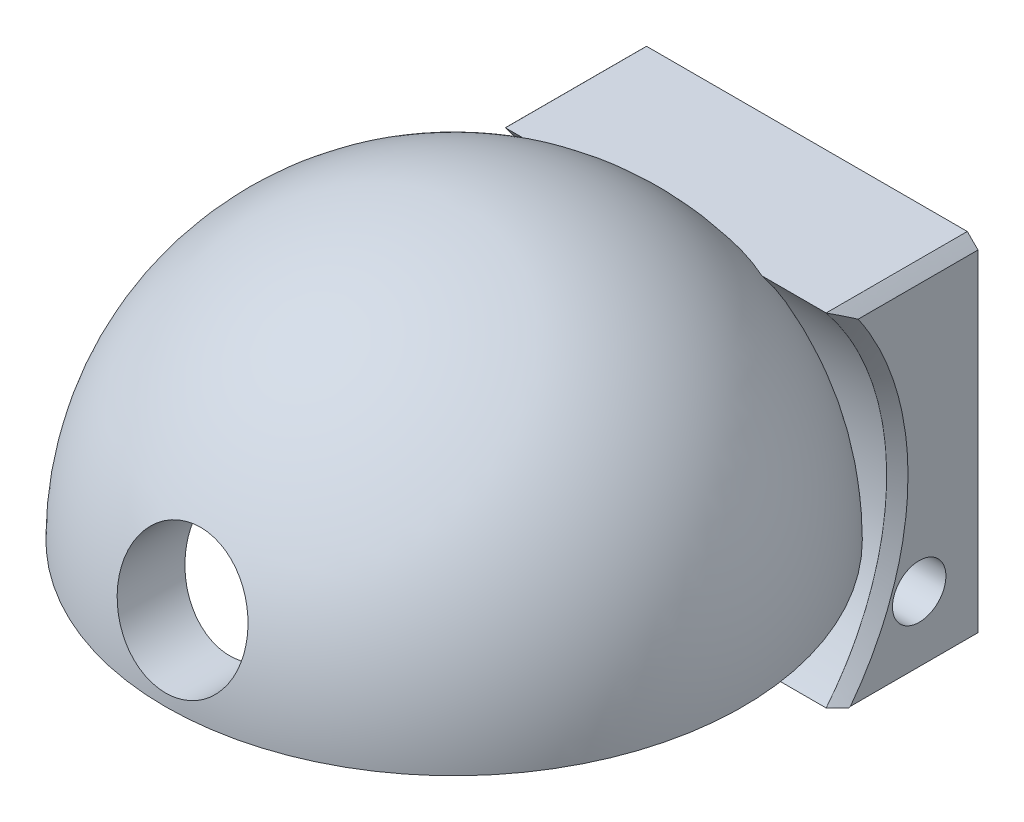
from build123d import *

# Parameters (mm, degrees)
BOSS_EXTRUDE1_REACH      = 42.773
BOSS_EXTRUDE1_END_RADIUS = 13.5
SKETCH3_W                = 9
SKETCH3_H                = 8
SKETCH3_R                = 1.25
SKETCH4_R                = 2.95
CUT_EXTRUDE1_DEPTH       = 39.618907907
BOSS_EXTRUDE2_DEPTH      = 3.5
FILLET1_SIZE             = 0.5
FILLET1_OF_MIRROR1_SIZE  = 0.5
SKETCH6_R                = 1.25
CUT_EXTRUDE2_DEPTH       = 40.847777024


with BuildPart() as part:
    # Sketch2 → Revolve1 (revolve)
    with BuildSketch(Plane.ZY.offset(3.25)):
        with BuildLine():
            Line((11.871988211, 18.951253904), (11.871988211, 21.951253904))
            ThreePointArc((11.871988211, 21.951253904), (2.326046665, 17.99719545), (-1.628011789, 8.451253904))
            Line((-1.628011789, 8.451253904), (1.371988211, 8.451253904))
            ThreePointArc((1.371988211, 8.451253904), (4.447367009, 15.875875106), (11.871988211, 18.951253904))
        make_face()
    revolve(axis=Axis((-3.25, 21.951253904, 11.871988211), (0, -1, 0)))

    # Boss-Extrude1: up to this sphere (the profile starts outside it)
    boss_extrude1_end = Location((-3.25, 8.451253904, 11.871988211)) * Sphere(BOSS_EXTRUDE1_END_RADIUS, mode=Mode.PRIVATE)
    # Sketch3 → Boss-Extrude1 (add, up to the surface)
    with BuildSketch(Plane.XY.offset(-4.628011789), mode=Mode.PRIVATE) as boss_extrude1_sk1:
        with Locations((-3.25, 12.451253904)):
            Rectangle(SKETCH3_W, SKETCH3_H)
        with Locations(Location((-3.25, 11.951253904, 0), (0, 0, 234.39930335))):
            Circle(SKETCH3_R, mode=Mode.SUBTRACT)
    boss_extrude1_tool1 = extrude(boss_extrude1_sk1.sketch, amount=BOSS_EXTRUDE1_REACH, mode=Mode.PRIVATE) - boss_extrude1_end
    add(boss_extrude1_tool1.solids().sort_by_distance((-3.25, 8.57167, -4.628012))[0])

    # Sketch4 → Cut-Extrude1 (cut, through all)
    with BuildSketch(Plane.XY.offset(-1.628011789)):
        with Locations(Location((-3.25, 11.951253904, 0), (0, 0, 220.0479249))):
            Circle(SKETCH4_R)
    extrude(amount=CUT_EXTRUDE1_DEPTH, mode=Mode.SUBTRACT)

    # Sketch5 → Boss-Extrude2 (add)
    with BuildSketch(Plane(origin=(1.25, 0, 0), x_dir=(0, 0, -1), z_dir=(1, 0, 0))):
        with BuildLine():
            Line((4.628011789, 16.451253904), (-1.972493274, 16.451253904))
            ThreePointArc((-1.972493274, 16.451253904), (0.128011789, 12.693894591), (0.85593385, 8.451253904))
            ThreePointArc((0.85593385, 8.451253904), (0.128011789, 4.208613217), (-1.972493274, 0.451253904))
            Line((-1.972493274, 0.451253904), (4.628011789, 0.451253904))
            Line((4.628011789, 0.451253904), (4.628011789, 16.451253904))
        make_face()
    boss_extrude2 = extrude(amount=BOSS_EXTRUDE2_DEPTH)

    # Fillet1
    # a fillet whose section is not a circle: 0.5 mm, written as the material it takes off along each edge
    with BuildSketch(Plane(origin=(4.75, 16.451253904, -5.878011789), x_dir=(0, -1, 0), z_dir=(0, 0, 1))) as fillet1_piece_1:
        with BuildLine():
            Bezier((FILLET1_SIZE, 0), (0, 0), (0, -FILLET1_SIZE), weights=[1, 0.007071068, 1])
            Line((0, -FILLET1_SIZE), (0, 0))
            Line((0, 0), (FILLET1_SIZE, 0))
        make_face()
    extrude(amount=9.100505063, mode=Mode.SUBTRACT)
    with BuildSketch(Plane(origin=(4.75, 8.451253904, 11.871988211), x_dir=(0, -0.701793953553333, -0.7123799876161475), z_dir=(0, -0.7123799876161475, 0.701793953553333))) as fillet1_piece_2:
        with BuildLine():
            Bezier((12.727922061 + FILLET1_SIZE, 0), (12.727922061, 0), (12.727922061, -FILLET1_SIZE), weights=[1, 0.007071068, 1])
            Line((12.727922061, -FILLET1_SIZE), (12.727922061, 0))
            Line((12.727922061, 0), (12.727922061 + FILLET1_SIZE, 0))
        make_face()
    revolve(axis=Axis((4.75, 8.451253904, 11.871988211), (1, 0, 0)), revolution_arc=89.142221862, mode=Mode.SUBTRACT)

    # Mirror1: Boss-Extrude2 across plane
    add(boss_extrude2.mirror(Plane.ZY.offset(3.25)))

    # Fillet1 of Mirror1
    # a fillet whose section is not a circle: 0.5 mm, written as the material it takes off along each edge
    with BuildSketch(Plane(origin=(-11.25, 16.451253904, -5.878011789), x_dir=(1, 0, 0), z_dir=(0, 0, 1))) as fillet1_of_mirror1_piece_1:
        with BuildLine():
            Bezier((FILLET1_OF_MIRROR1_SIZE, 0), (0, 0), (0, -FILLET1_OF_MIRROR1_SIZE), weights=[1, 0.007071068, 1])
            Line((0, -FILLET1_OF_MIRROR1_SIZE), (0, 0))
            Line((0, 0), (FILLET1_OF_MIRROR1_SIZE, 0))
        make_face()
    extrude(amount=9.100505063, mode=Mode.SUBTRACT)
    with BuildSketch(Plane(origin=(-11.25, 8.451253904, 11.871988211), x_dir=(9.769464187365758e-15, -0.701793953553333, -0.7123799876161475), z_dir=(9.869955665254962e-15, -0.7123799876161475, 0.701793953553333))) as fillet1_of_mirror1_piece_2:
        with BuildLine():
            Bezier((12.727922061 + FILLET1_OF_MIRROR1_SIZE, 0), (12.727922061, 0), (12.727922061, FILLET1_OF_MIRROR1_SIZE), weights=[1, 0.007071068, 1])
            Line((12.727922061, FILLET1_OF_MIRROR1_SIZE), (12.727922061, 0))
            Line((12.727922061, 0), (12.727922061 + FILLET1_OF_MIRROR1_SIZE, 0))
        make_face()
    revolve(axis=Axis((-11.25, 8.451253904, 11.871988211), (1, 0, 0)), revolution_arc=89.142221862, mode=Mode.SUBTRACT)

    # Sketch6 → Cut-Extrude2 (cut, through all)
    with BuildSketch(Plane(origin=(4.75, 0, 0), x_dir=(0, 0, -1), z_dir=(1, 0, 0))):
        with Locations(Location((1.878011789, 3.496708449, 0), (0, 0, 270))):
            Circle(SKETCH6_R)
    extrude(amount=-CUT_EXTRUDE2_DEPTH, mode=Mode.SUBTRACT)


solid = part.part
